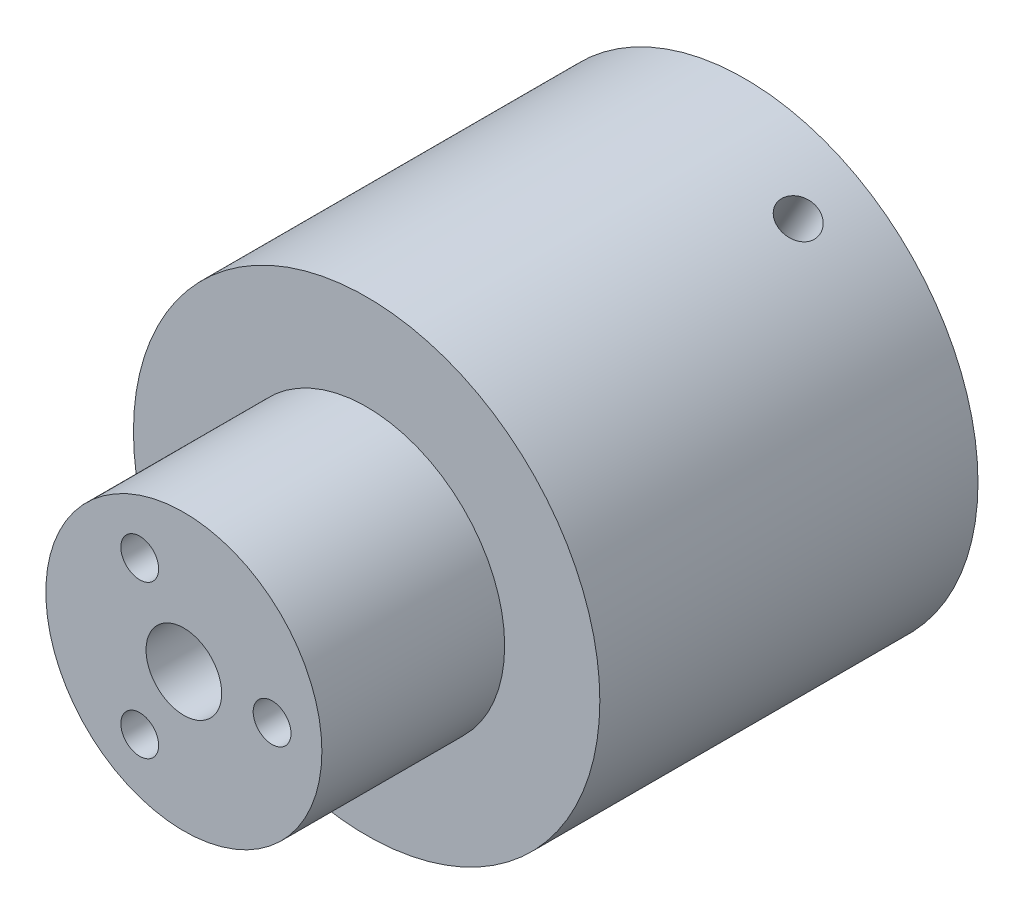
from build123d import *

# Parameters (mm, degrees)
SKETCH1_R           = 18.5
BOSS_EXTRUDE1_DEPTH = 23
SKETCH2_R           = 10.95
BOSS_EXTRUDE2_DEPTH = 3.5
SKETCH4_R           = 3.05
CUT_EXTRUDE1_DEPTH  = 4.1
SKETCH5_R           = 1.5
CUT_EXTRUDE2_DEPTH  = 4
SKETCH7_R           = 10.95
SKETCH7_R_2         = 3
BOSS_EXTRUDE3_DEPTH = 11
SKETCH9_R           = 1.5
CUT_EXTRUDE4_DEPTH  = 46.724719791
SKETCH10_R          = 3
CUT_EXTRUDE5_DEPTH  = 46.724719791
SKETCH11_R          = 3.25
CUT_EXTRUDE8_DEPTH  = 30
BOSS_EXTRUDE4_START = 7
SKETCH12_R          = 18.5
SKETCH12_R_2        = 3.25
SKETCH12_R_3        = 3.05
BOSS_EXTRUDE4_DEPTH = 7
CUT_EXTRUDE9_START  = -5
SKETCH13_R          = 1.5
CUT_EXTRUDE9_DEPTH  = 17
CIRPATTERN1_COUNT   = 3


with BuildPart() as part:
    # Sketch1 → Boss-Extrude1 (new body)
    with BuildSketch(Plane.XY):
        Circle(SKETCH1_R)
    extrude(amount=BOSS_EXTRUDE1_DEPTH)

    # Sketch2 → Boss-Extrude2 (add)
    with BuildSketch(Plane.XY.offset(23)):
        Circle(SKETCH2_R)
    extrude(amount=BOSS_EXTRUDE2_DEPTH)

    # Sketch4 → Cut-Extrude1 (cut)
    with BuildSketch(Plane(origin=(0, 0, 0), x_dir=(-1, 0, 0), z_dir=(0, 0, -1))):
        Circle(SKETCH4_R)
    extrude(amount=-CUT_EXTRUDE1_DEPTH, mode=Mode.SUBTRACT)

    # Sketch5 → Cut-Extrude2 (cut)
    with BuildSketch(Plane(origin=(0, 0, 4.1), x_dir=(-1, 0, 0), z_dir=(0, 0, -1))):
        Circle(SKETCH5_R)
    extrude(amount=-CUT_EXTRUDE2_DEPTH, mode=Mode.SUBTRACT)

    # Sketch7 → Boss-Extrude3 (add)
    with BuildSketch(Plane.XY.offset(26.5)):
        Circle(SKETCH7_R)
        Circle(SKETCH7_R_2, mode=Mode.SUBTRACT)
    extrude(amount=BOSS_EXTRUDE3_DEPTH)

    # Sketch9 → Cut-Extrude4 (cut, through all)
    with BuildSketch(Plane.XY.offset(37.5)):
        with Locations((7, 0)):
            Circle(SKETCH9_R)
        with Locations((-3.5, -6.062177826)):
            Circle(SKETCH9_R)
        with Locations((-3.5, 6.062177826)):
            Circle(SKETCH9_R)
    extrude(amount=-CUT_EXTRUDE4_DEPTH, mode=Mode.SUBTRACT)

    # Sketch10 → Cut-Extrude5 (cut, through all)
    with BuildSketch(Plane.XY.offset(37.5)):
        Circle(SKETCH10_R)
    extrude(amount=-CUT_EXTRUDE5_DEPTH, mode=Mode.SUBTRACT)

    # Sketch11 → Cut-Extrude8 (cut)
    with BuildSketch(Plane(origin=(0, 0, 0), x_dir=(-1, 0, 0), z_dir=(0, 0, -1))):
        with Locations((3.5, -6.062177826)):
            Circle(SKETCH11_R)
        with Locations((3.5, 6.062177826)):
            Circle(SKETCH11_R)
        with Locations((-7, 0)):
            Circle(SKETCH11_R)
    extrude(amount=-CUT_EXTRUDE8_DEPTH, mode=Mode.SUBTRACT)

    # Sketch12 → Boss-Extrude4 (add)
    with BuildSketch(Plane(origin=(0, 0, 0), x_dir=(-1, 0, 0), z_dir=(0, 0, -1)).offset(BOSS_EXTRUDE4_START)):
        Circle(SKETCH12_R)
        with Locations((3.5, 6.062177826)):
            Circle(SKETCH12_R_2, mode=Mode.SUBTRACT)
        with Locations((3.5, -6.062177826)):
            Circle(SKETCH12_R_2, mode=Mode.SUBTRACT)
        with Locations((-7, 0)):
            Circle(SKETCH12_R_2, mode=Mode.SUBTRACT)
        Circle(SKETCH12_R_3, mode=Mode.SUBTRACT)
    extrude(amount=-BOSS_EXTRUDE4_DEPTH)

    # Sketch13 → Cut-Extrude9 (cut)
    with BuildSketch(Plane(origin=(0, 0, 0), x_dir=(0, 0, -1), z_dir=(1, 0, 0)).offset(CUT_EXTRUDE9_START)):
        with Locations((2, 0)):
            Circle(SKETCH13_R)
    cut_extrude9 = extrude(amount=-CUT_EXTRUDE9_DEPTH, mode=Mode.SUBTRACT)

    # CirPattern1: Cut-Extrude9 ×3 about axis
    cirpattern1_axis = Axis((0, 0, 23), (0, 0, -1))
    for i in range(1, CIRPATTERN1_COUNT):
        add(cut_extrude9.rotate(cirpattern1_axis, i * 360 / CIRPATTERN1_COUNT), mode=Mode.SUBTRACT)


solid = part.part
